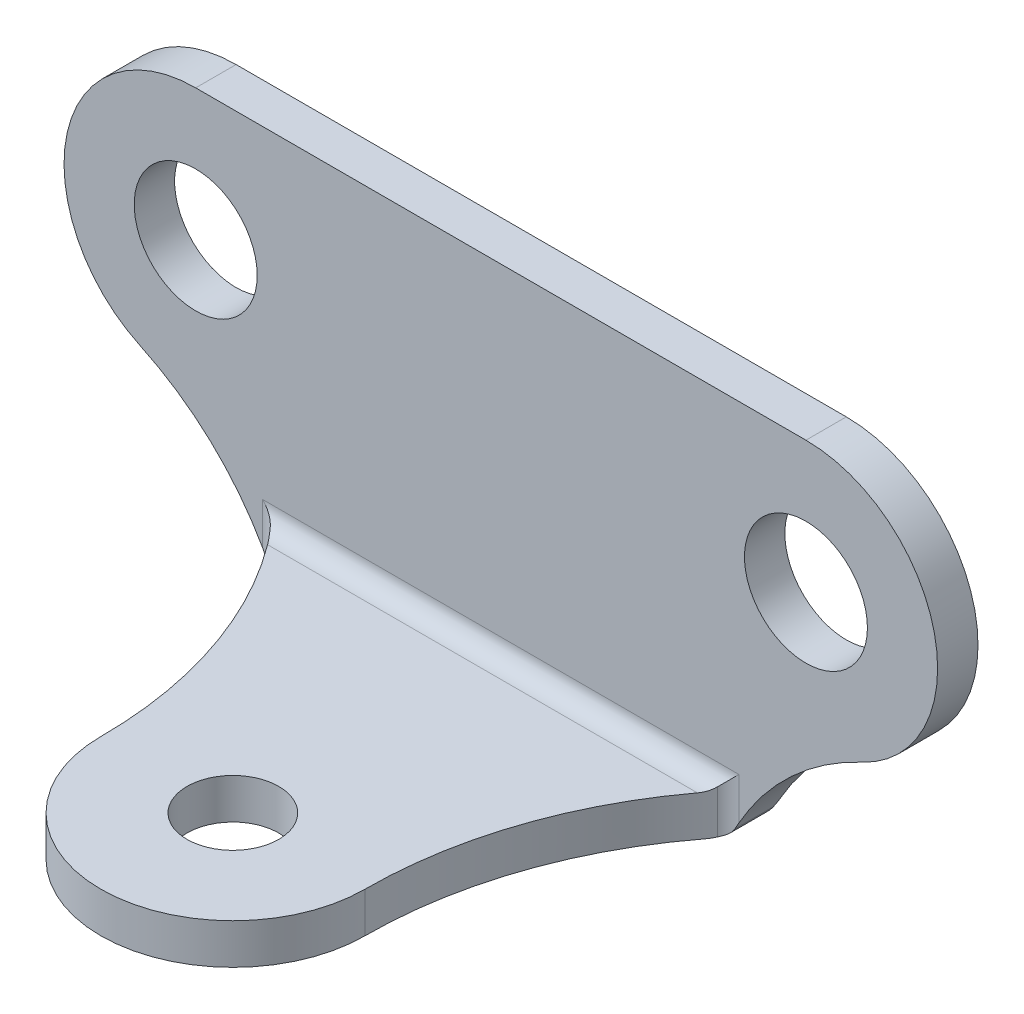
from build123d import *

# Parameters (mm, degrees)
ESBO_O1_R                  = 3.35
RESSALTO_EXTRUS_O1_DEPTH   = 2.2
ESBO_O2_W                  = 25
ESBO_O2_H                  = 2.2
RESSALTO_EXTRUS_O2_DEPTH   = 21.8
CORTE_EXTRUS_O2_DEPTH      = 40.687277558
CORTE_EXTRUS_O2_DEPTH_BACK = 24
ESBO_O3_R                  = 2.5
FILETE1_R                  = 1


with BuildPart() as part:
    # Esboço1 → Ressalto-extrusão1 (new body)
    with BuildSketch(Plane.XY):
        with BuildLine():
            Line((16.625, 7.175), (-16.625, 7.175))
            ThreePointArc((-16.625, 7.175), (-23.628167932, 1.560853588), (-19.671946284, -6.495902042))
            ThreePointArc((-19.671946284, -6.495902042), (-15.467093732, -9.437851933), (-12.5, -13.625))
            Line((-12.5, -13.625), (12.5, -13.625))
            ThreePointArc((12.5, -13.625), (15.467093732, -9.437851933), (19.671946284, -6.495902042))
            ThreePointArc((19.671946284, -6.495902042), (23.628167932, 1.560853588), (16.625, 7.175))
        make_face()
        with Locations((-16.625, 0)):
            Circle(ESBO_O1_R, mode=Mode.SUBTRACT)
        with Locations((16.625, 0)):
            Circle(ESBO_O1_R, mode=Mode.SUBTRACT)
    extrude(amount=RESSALTO_EXTRUS_O1_DEPTH)

    # Esboço2 → Ressalto-extrusão2 (add)
    with BuildSketch(Plane.XY.offset(2.2)):
        with Locations((0, -12.525)):
            Rectangle(ESBO_O2_W, ESBO_O2_H)
    extrude(amount=RESSALTO_EXTRUS_O2_DEPTH)

    # Esboço3 → Corte-extrusão2 (cut, two sides: drawn at the far end of the back side and taken through both)
    with BuildSketch(Plane.XZ.offset(13.625).offset(-CORTE_EXTRUS_O2_DEPTH_BACK)):
        with BuildLine():
            ThreePointArc((-12.5, 2.2), (-8.565992578, 9.033887716), (-7.2, 16.8))
            ThreePointArc((-7.2, 16.8), (-5.091168815, 21.891168834), (2.7e-08, 24))
            Line((2.7e-08, 24), (-12.5, 24))
            Line((-12.5, 24), (-12.5, 2.2))
        make_face()
        with BuildLine():
            Line((12.5, 24), (2.7e-08, 24))
            ThreePointArc((2.7e-08, 24), (5.091168834, 21.891168815), (7.2, 16.8))
            ThreePointArc((7.2, 16.8), (8.565992578, 9.033887716), (12.5, 2.2))
            Line((12.5, 2.2), (12.5, 24))
        make_face()
        with Locations((0, 16.8)):
            Circle(ESBO_O3_R)
    extrude(amount=CORTE_EXTRUS_O2_DEPTH + CORTE_EXTRUS_O2_DEPTH_BACK, mode=Mode.SUBTRACT)

    # Filete1
    filete1_edges = [part.edges().sort_by_distance(p)[0] for p in [
        (12.5, -12.525, 2.2),
        (-12.5, -12.525, 2.2),
        (0, -11.425, 2.2),
    ]]
    fillet(filete1_edges, radius=FILETE1_R)
    filete1_2_edges = [part.edges().sort_by_distance(p)[0] for p in [
        (12.5, -13.625, 1.159674218),
        (0, -13.625, 0),
        (-12.5, -13.625, 1.159674218),
    ]]
    fillet(filete1_2_edges, radius=FILETE1_R)


solid = part.part
